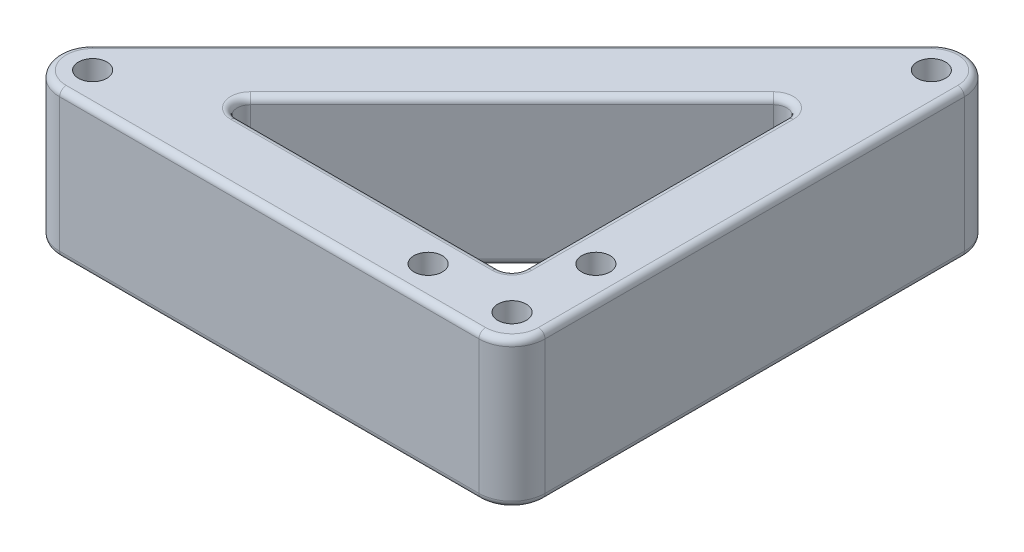
from build123d import *

# Parameters (mm, degrees)
SKETCH1_R           = 2.15
BOSS_EXTRUDE1_DEPTH = 22.2504
FILLET1_R           = 5
FILLET2_R           = 2
FILLET3_R           = 1


with BuildPart() as part:
    # Sketch1 → Boss-Extrude1 (new body)
    with BuildSketch(Plane(origin=(0, 0, 0), x_dir=(1, 0, 0), z_dir=(0, 1, 0))):
        with BuildLine():
            Line((59.964466094, 67.035533906), (-3.535533906, 3.535533906))
            ThreePointArc((-3.535533906, 3.535533906), (-4.619397663, -1.913417162), (0, -5))
            Line((0, -5), (68.5, -5))
            Line((68.5, -5), (68.5, 63.5))
            ThreePointArc((68.5, 63.5), (65.413417162, 68.119397663), (59.964466094, 67.035533906))
        make_face()
        Polygon((12.071067812, 5), (58.5, 51.428932188), (58.5, 5), align=None, mode=Mode.SUBTRACT)
        Circle(SKETCH1_R, mode=Mode.SUBTRACT)
        with Locations((63.5, 63.5)):
            Circle(SKETCH1_R, mode=Mode.SUBTRACT)
        with Locations((50.8, 0)):
            Circle(SKETCH1_R, mode=Mode.SUBTRACT)
        with Locations((63.5, 0)):
            Circle(SKETCH1_R, mode=Mode.SUBTRACT)
        with Locations((63.5, 12.7)):
            Circle(SKETCH1_R, mode=Mode.SUBTRACT)
    extrude(amount=BOSS_EXTRUDE1_DEPTH)

    # Fillet1
    fillet1_edges = [part.edges().sort_by_distance(p)[0] for p in [
        (68.5, 11.1252, 5),
    ]]
    fillet(fillet1_edges, radius=FILLET1_R)

    # Fillet2
    fillet2_edges = [part.edges().sort_by_distance(p)[0] for p in [
        (58.5, 11.1252, -51.428932188),
        (58.5, 11.1252, -5),
        (12.071067812, 11.1252, -5),
    ]]
    fillet(fillet2_edges, radius=FILLET2_R)

    # Fillet3
    fillet3_edges = [part.edges().sort_by_distance(p)[0] for p in [
        (15.051735872, 0, -6.234633135),
        (36.699747468, 0, -5),
        (57.914213562, 0, -5.585786438),
        (58.5, 0, -26.800252532),
        (57.265366865, 0, -48.448264128),
        (-4.619397663, 0, 1.913417162),
        (28.214466094, 0, -35.285533906),
        (65.413417162, 0, -68.119397663),
        (68.5, 0, -31.75),
        (67.035533906, 0, 3.535533906),
        (15.051735872, 22.2504, -6.234633135),
        (35.285533906, 22.2504, -28.214466094),
        (57.265366865, 22.2504, -48.448264128),
        (58.5, 22.2504, -26.800252532),
        (57.914213562, 22.2504, -5.585786438),
        (-4.619397663, 22.2504, 1.913417162),
        (28.214466094, 22.2504, -35.285533906),
        (65.413417162, 22.2504, -68.119397663),
        (68.5, 22.2504, -31.75),
        (67.035533906, 22.2504, 3.535533906),
        (35.285533906, 0, -28.214466094),
        (31.75, 0, 5),
        (36.699747468, 22.2504, -5),
        (31.75, 22.2504, 5),
    ]]
    fillet(fillet3_edges, radius=FILLET3_R)


solid = part.part
